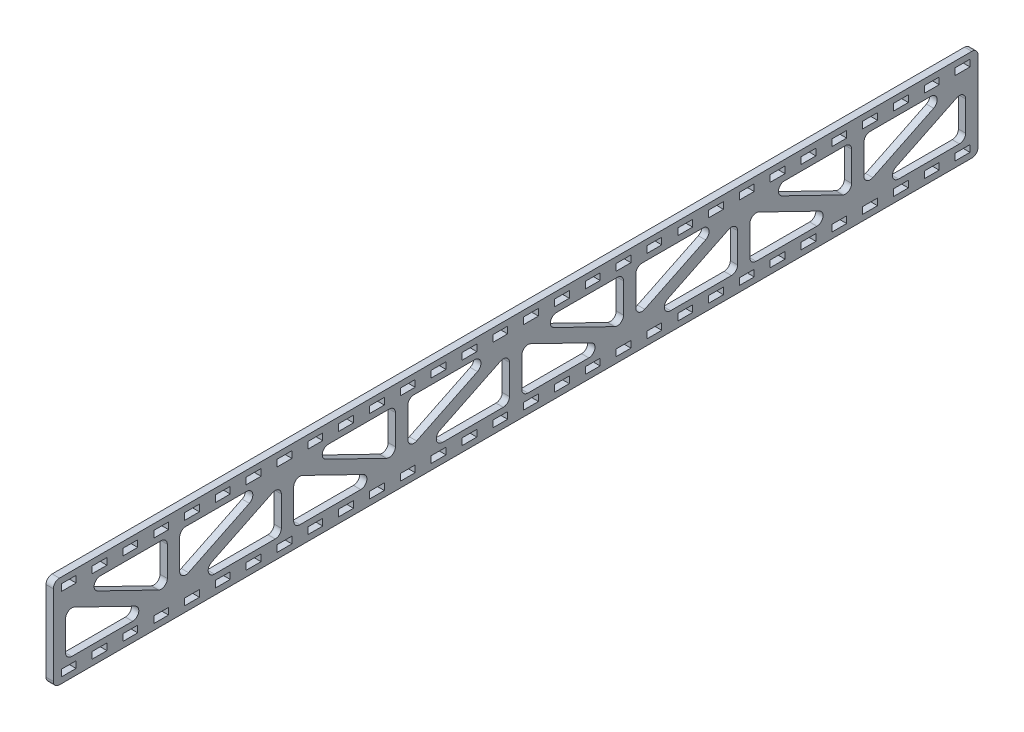
from build123d import *

# Parameters (mm, degrees)
SKETCH1_W          = 381
SKETCH1_H          = 38.1
OUTER_CUT_DEPTH    = 1.4986
CUT_EXTRUDE1_DEPTH = 192.473590105
FILLET1_R          = 2.54
SKETCH2_W          = 6.096
SKETCH2_H          = 2.746000096
SLOT_DEPTH         = 192.473590105
SLOTS_COUNT        = 16
SLOTS_PITCH        = 12.7
SLOTS_COUNT_DIR2   = 16
SLOTS_PITCH_DIR2   = 12.7


with BuildPart() as part:
    # Sketch1 → Outer Cut (new, symmetric)
    with BuildSketch(Plane(origin=(0, 0, 0), x_dir=(0, 0, -1), z_dir=(1, 0, 0))):
        Rectangle(SKETCH1_W, SKETCH1_H)
    extrude(amount=OUTER_CUT_DEPTH, both=True)

    # Sketch3 → Cut-Extrude1 (cut, through all)
    with BuildSketch(Plane(origin=(1.4986, 0, 0), x_dir=(0, 0, -1), z_dir=(1, 0, 0))):
        Polygon((-185.42, 7.369701451), (-185.42, -11.43), (-146.776169239, -11.43), align=None)
        Polygon((-143.51, 11.43), (-182.153830761, 11.43), (-143.51, -7.369701451), align=None)
        Polygon((-99.786169239, 11.43), (-138.43, 11.43), (-138.43, -7.369701451), align=None)
        Polygon((-96.52, 7.369701451), (-135.163830761, -11.43), (-96.52, -11.43), align=None)
        Polygon((-91.44, 7.369701451), (-91.44, -11.43), (-52.796169239, -11.43), align=None)
        Polygon((-49.53, 11.43), (-88.173830761, 11.43), (-49.53, -7.369701451), align=None)
        Polygon((-5.806169239, 11.43), (-44.45, 11.43), (-44.45, -7.369701451), align=None)
        Polygon((-41.183830761, -11.43), (-2.54, -11.43), (-2.54, 7.369701451), align=None)
        Polygon((2.54, -11.43), (41.183830761, -11.43), (2.54, 7.369701451), align=None)
        Polygon((44.45, -7.369701451), (44.45, 11.43), (5.806169239, 11.43), align=None)
        Polygon((49.53, -7.369701451), (88.173830761, 11.43), (49.53, 11.43), align=None)
        Polygon((52.796169239, -11.43), (91.44, -11.43), (91.44, 7.369701451), align=None)
        Polygon((96.52, -11.43), (135.163830761, -11.43), (96.52, 7.369701451), align=None)
        Polygon((138.43, -7.369701451), (138.43, 11.43), (99.786169239, 11.43), align=None)
        Polygon((143.51, -7.369701451), (182.153830761, 11.43), (143.51, 11.43), align=None)
        Polygon((146.776169239, -11.43), (185.42, -11.43), (185.42, 7.369701451), align=None)
    extrude(amount=-CUT_EXTRUDE1_DEPTH, mode=Mode.SUBTRACT)

    # Fillet1
    fillet1_edges = [part.edges().sort_by_distance(p)[0] for p in [
        (0, 7.369701451, 91.44),
        (0, -11.43, 52.796169239),
        (0, -11.43, 91.44),
        (0, 11.43, -99.786169239),
        (0, 11.43, -138.43),
        (0, -7.369701451, -138.43),
        (0, -7.369701451, -143.51),
        (0, 11.43, -143.51),
        (0, 11.43, -182.153830761),
        (0, 7.369701451, -185.42),
        (0, -11.43, -185.42),
        (0, -11.43, -146.776169239),
        (0, 11.43, -5.806169239),
        (0, 11.43, -44.45),
        (0, -7.369701451, -44.45),
        (0, -7.369701451, -49.53),
        (0, 11.43, -49.53),
        (0, 11.43, -88.173830761),
        (0, -11.43, -52.796169239),
        (0, 7.369701451, -91.44),
        (0, -11.43, -91.44),
        (0, 7.369701451, -96.52),
        (0, -11.43, -135.163830761),
        (0, -11.43, -96.52),
        (0, 7.369701451, 185.42),
        (0, -11.43, 146.776169239),
        (0, -11.43, 185.42),
        (0, 11.43, 88.173830761),
        (0, 11.43, 49.53),
        (0, -7.369701451, 49.53),
        (0, -7.369701451, 44.45),
        (0, 11.43, 44.45),
        (0, 11.43, 5.806169239),
        (0, -11.43, 41.183830761),
        (0, 7.369701451, 2.54),
        (0, 19.05, 190.5),
        (0, -11.43, 2.54),
        (0, 19.05, -190.5),
        (0, -19.05, -190.5),
        (0, -19.05, 190.5),
        (0, 7.369701451, -2.54),
        (0, -11.43, -41.183830761),
        (0, -11.43, -2.54),
        (0, 11.43, 182.153830761),
        (0, 11.43, 143.51),
        (0, -7.369701451, 143.51),
        (0, -7.369701451, 138.43),
        (0, 11.43, 138.43),
        (0, 11.43, 99.786169239),
        (0, -11.43, 135.163830761),
        (0, 7.369701451, 96.52),
        (0, -11.43, 96.52),
    ]]
    fillet(fillet1_edges, radius=FILLET1_R)

    # Sketch2 → Slot (cut, through all)
    with BuildSketch(Plane(origin=(1.4986, 0, 0), x_dir=(0, 0, -1), z_dir=(1, 0, 0))):
        with Locations((6.35, 15.24)):
            Rectangle(SKETCH2_W, SKETCH2_H)
    slot = extrude(amount=-SLOT_DEPTH, mode=Mode.SUBTRACT)

    # Slots: Slot 16 × 16
    with Locations(*[Vector(0, 0, 1) * (i * SLOTS_PITCH) + Vector(0, 0, -1) * (j * SLOTS_PITCH_DIR2) for i in range(SLOTS_COUNT) for j in range(SLOTS_COUNT_DIR2) if (i, j) != (0, 0)]):
        add(slot, mode=Mode.SUBTRACT)

    # Mirror1: read off the stored shape, not the designer's step
    # Mirror1: loft between two sections, ruled curve by curve
    mirror1_from = [
        Edge.make_line((1.4986, -13.866999952, -9.398), (1.4986, -16.613000048, -9.398)),
        Edge.make_line((1.4986, -16.613000048, -3.302), (1.4986, -13.866999952, -3.302)),
        Edge.make_line((1.4986, -16.613000048, -9.398), (1.4986, -16.613000048, -3.302)),
        Edge.make_line((1.4986, -13.866999952, -3.302), (1.4986, -13.866999952, -9.398)),
    ]
    mirror1_to = [
        Edge.make_line((-1.4986, -13.866999952, -9.398), (-1.4986, -16.613000048, -9.398)),
        Edge.make_line((-1.4986, -16.613000048, -3.302), (-1.4986, -13.866999952, -3.302)),
        Edge.make_line((-1.4986, -16.613000048, -9.398), (-1.4986, -16.613000048, -3.302)),
        Edge.make_line((-1.4986, -13.866999952, -3.302), (-1.4986, -13.866999952, -9.398)),
    ]
    mirror1 = Solid(Shell([*[Face.make_surface_from_curves(mirror1_from[k], mirror1_to[k]) for k in range(4)], Face(Wire(mirror1_from)), Face(Wire(mirror1_to))]))
    add(mirror1, mode=Mode.SUBTRACT)

    # Mirror1 2: loft between two sections, ruled curve by curve
    mirror1_2_from = [
        Edge.make_line((1.4986, -13.866999952, -22.098), (1.4986, -16.613000048, -22.098)),
        Edge.make_line((1.4986, -16.613000048, -16.002), (1.4986, -13.866999952, -16.002)),
        Edge.make_line((1.4986, -16.613000048, -22.098), (1.4986, -16.613000048, -16.002)),
        Edge.make_line((1.4986, -13.866999952, -16.002), (1.4986, -13.866999952, -22.098)),
    ]
    mirror1_2_to = [
        Edge.make_line((-1.4986, -13.866999952, -22.098), (-1.4986, -16.613000048, -22.098)),
        Edge.make_line((-1.4986, -16.613000048, -16.002), (-1.4986, -13.866999952, -16.002)),
        Edge.make_line((-1.4986, -16.613000048, -22.098), (-1.4986, -16.613000048, -16.002)),
        Edge.make_line((-1.4986, -13.866999952, -16.002), (-1.4986, -13.866999952, -22.098)),
    ]
    mirror1_2 = Solid(Shell([*[Face.make_surface_from_curves(mirror1_2_from[k], mirror1_2_to[k]) for k in range(4)], Face(Wire(mirror1_2_from)), Face(Wire(mirror1_2_to))]))
    add(mirror1_2, mode=Mode.SUBTRACT)

    # Mirror1 3: loft between two sections, ruled curve by curve
    mirror1_3_from = [
        Edge.make_line((1.4986, -13.866999952, -136.398), (1.4986, -16.613000048, -136.398)),
        Edge.make_line((1.4986, -16.613000048, -130.302), (1.4986, -13.866999952, -130.302)),
        Edge.make_line((1.4986, -16.613000048, -136.398), (1.4986, -16.613000048, -130.302)),
        Edge.make_line((1.4986, -13.866999952, -130.302), (1.4986, -13.866999952, -136.398)),
    ]
    mirror1_3_to = [
        Edge.make_line((-1.4986, -13.866999952, -136.398), (-1.4986, -16.613000048, -136.398)),
        Edge.make_line((-1.4986, -16.613000048, -130.302), (-1.4986, -13.866999952, -130.302)),
        Edge.make_line((-1.4986, -16.613000048, -136.398), (-1.4986, -16.613000048, -130.302)),
        Edge.make_line((-1.4986, -13.866999952, -130.302), (-1.4986, -13.866999952, -136.398)),
    ]
    mirror1_3 = Solid(Shell([*[Face.make_surface_from_curves(mirror1_3_from[k], mirror1_3_to[k]) for k in range(4)], Face(Wire(mirror1_3_from)), Face(Wire(mirror1_3_to))]))
    add(mirror1_3, mode=Mode.SUBTRACT)

    # Mirror1 4: loft between two sections, ruled curve by curve
    mirror1_4_from = [
        Edge.make_line((1.4986, -13.866999952, -149.098), (1.4986, -16.613000048, -149.098)),
        Edge.make_line((1.4986, -16.613000048, -143.002), (1.4986, -13.866999952, -143.002)),
        Edge.make_line((1.4986, -16.613000048, -149.098), (1.4986, -16.613000048, -143.002)),
        Edge.make_line((1.4986, -13.866999952, -143.002), (1.4986, -13.866999952, -149.098)),
    ]
    mirror1_4_to = [
        Edge.make_line((-1.4986, -13.866999952, -149.098), (-1.4986, -16.613000048, -149.098)),
        Edge.make_line((-1.4986, -16.613000048, -143.002), (-1.4986, -13.866999952, -143.002)),
        Edge.make_line((-1.4986, -16.613000048, -149.098), (-1.4986, -16.613000048, -143.002)),
        Edge.make_line((-1.4986, -13.866999952, -143.002), (-1.4986, -13.866999952, -149.098)),
    ]
    mirror1_4 = Solid(Shell([*[Face.make_surface_from_curves(mirror1_4_from[k], mirror1_4_to[k]) for k in range(4)], Face(Wire(mirror1_4_from)), Face(Wire(mirror1_4_to))]))
    add(mirror1_4, mode=Mode.SUBTRACT)

    # Mirror1 5: loft between two sections, ruled curve by curve
    mirror1_5_from = [
        Edge.make_line((1.4986, -13.866999952, -161.798), (1.4986, -16.613000048, -161.798)),
        Edge.make_line((1.4986, -16.613000048, -155.702), (1.4986, -13.866999952, -155.702)),
        Edge.make_line((1.4986, -16.613000048, -161.798), (1.4986, -16.613000048, -155.702)),
        Edge.make_line((1.4986, -13.866999952, -155.702), (1.4986, -13.866999952, -161.798)),
    ]
    mirror1_5_to = [
        Edge.make_line((-1.4986, -13.866999952, -161.798), (-1.4986, -16.613000048, -161.798)),
        Edge.make_line((-1.4986, -16.613000048, -155.702), (-1.4986, -13.866999952, -155.702)),
        Edge.make_line((-1.4986, -16.613000048, -161.798), (-1.4986, -16.613000048, -155.702)),
        Edge.make_line((-1.4986, -13.866999952, -155.702), (-1.4986, -13.866999952, -161.798)),
    ]
    mirror1_5 = Solid(Shell([*[Face.make_surface_from_curves(mirror1_5_from[k], mirror1_5_to[k]) for k in range(4)], Face(Wire(mirror1_5_from)), Face(Wire(mirror1_5_to))]))
    add(mirror1_5, mode=Mode.SUBTRACT)

    # Mirror1 6: loft between two sections, ruled curve by curve
    mirror1_6_from = [
        Edge.make_line((1.4986, -13.866999952, -174.498), (1.4986, -16.613000048, -174.498)),
        Edge.make_line((1.4986, -16.613000048, -168.402), (1.4986, -13.866999952, -168.402)),
        Edge.make_line((1.4986, -16.613000048, -174.498), (1.4986, -16.613000048, -168.402)),
        Edge.make_line((1.4986, -13.866999952, -168.402), (1.4986, -13.866999952, -174.498)),
    ]
    mirror1_6_to = [
        Edge.make_line((-1.4986, -13.866999952, -174.498), (-1.4986, -16.613000048, -174.498)),
        Edge.make_line((-1.4986, -16.613000048, -168.402), (-1.4986, -13.866999952, -168.402)),
        Edge.make_line((-1.4986, -16.613000048, -174.498), (-1.4986, -16.613000048, -168.402)),
        Edge.make_line((-1.4986, -13.866999952, -168.402), (-1.4986, -13.866999952, -174.498)),
    ]
    mirror1_6 = Solid(Shell([*[Face.make_surface_from_curves(mirror1_6_from[k], mirror1_6_to[k]) for k in range(4)], Face(Wire(mirror1_6_from)), Face(Wire(mirror1_6_to))]))
    add(mirror1_6, mode=Mode.SUBTRACT)

    # Mirror1 7: loft between two sections, ruled curve by curve
    mirror1_7_from = [
        Edge.make_line((1.4986, -13.866999952, -187.198), (1.4986, -16.613000048, -187.198)),
        Edge.make_line((1.4986, -16.613000048, -181.102), (1.4986, -13.866999952, -181.102)),
        Edge.make_line((1.4986, -16.613000048, -187.198), (1.4986, -16.613000048, -181.102)),
        Edge.make_line((1.4986, -13.866999952, -181.102), (1.4986, -13.866999952, -187.198)),
    ]
    mirror1_7_to = [
        Edge.make_line((-1.4986, -13.866999952, -187.198), (-1.4986, -16.613000048, -187.198)),
        Edge.make_line((-1.4986, -16.613000048, -181.102), (-1.4986, -13.866999952, -181.102)),
        Edge.make_line((-1.4986, -16.613000048, -187.198), (-1.4986, -16.613000048, -181.102)),
        Edge.make_line((-1.4986, -13.866999952, -181.102), (-1.4986, -13.866999952, -187.198)),
    ]
    mirror1_7 = Solid(Shell([*[Face.make_surface_from_curves(mirror1_7_from[k], mirror1_7_to[k]) for k in range(4)], Face(Wire(mirror1_7_from)), Face(Wire(mirror1_7_to))]))
    add(mirror1_7, mode=Mode.SUBTRACT)

    # Mirror1 8: loft between two sections, ruled curve by curve
    mirror1_8_from = [
        Edge.make_line((1.4986, -13.866999952, 3.302), (1.4986, -16.613000048, 3.302)),
        Edge.make_line((1.4986, -16.613000048, 9.398), (1.4986, -13.866999952, 9.398)),
        Edge.make_line((1.4986, -16.613000048, 3.302), (1.4986, -16.613000048, 9.398)),
        Edge.make_line((1.4986, -13.866999952, 9.398), (1.4986, -13.866999952, 3.302)),
    ]
    mirror1_8_to = [
        Edge.make_line((-1.4986, -13.866999952, 3.302), (-1.4986, -16.613000048, 3.302)),
        Edge.make_line((-1.4986, -16.613000048, 9.398), (-1.4986, -13.866999952, 9.398)),
        Edge.make_line((-1.4986, -16.613000048, 3.302), (-1.4986, -16.613000048, 9.398)),
        Edge.make_line((-1.4986, -13.866999952, 9.398), (-1.4986, -13.866999952, 3.302)),
    ]
    mirror1_8 = Solid(Shell([*[Face.make_surface_from_curves(mirror1_8_from[k], mirror1_8_to[k]) for k in range(4)], Face(Wire(mirror1_8_from)), Face(Wire(mirror1_8_to))]))
    add(mirror1_8, mode=Mode.SUBTRACT)

    # Mirror1 9: loft between two sections, ruled curve by curve
    mirror1_9_from = [
        Edge.make_line((1.4986, -13.866999952, 16.002), (1.4986, -16.613000048, 16.002)),
        Edge.make_line((1.4986, -16.613000048, 22.098), (1.4986, -13.866999952, 22.098)),
        Edge.make_line((1.4986, -16.613000048, 16.002), (1.4986, -16.613000048, 22.098)),
        Edge.make_line((1.4986, -13.866999952, 22.098), (1.4986, -13.866999952, 16.002)),
    ]
    mirror1_9_to = [
        Edge.make_line((-1.4986, -13.866999952, 16.002), (-1.4986, -16.613000048, 16.002)),
        Edge.make_line((-1.4986, -16.613000048, 22.098), (-1.4986, -13.866999952, 22.098)),
        Edge.make_line((-1.4986, -16.613000048, 16.002), (-1.4986, -16.613000048, 22.098)),
        Edge.make_line((-1.4986, -13.866999952, 22.098), (-1.4986, -13.866999952, 16.002)),
    ]
    mirror1_9 = Solid(Shell([*[Face.make_surface_from_curves(mirror1_9_from[k], mirror1_9_to[k]) for k in range(4)], Face(Wire(mirror1_9_from)), Face(Wire(mirror1_9_to))]))
    add(mirror1_9, mode=Mode.SUBTRACT)

    # Mirror1 10: loft between two sections, ruled curve by curve
    mirror1_10_from = [
        Edge.make_line((1.4986, -13.866999952, -123.698), (1.4986, -16.613000048, -123.698)),
        Edge.make_line((1.4986, -16.613000048, -117.602), (1.4986, -13.866999952, -117.602)),
        Edge.make_line((1.4986, -16.613000048, -123.698), (1.4986, -16.613000048, -117.602)),
        Edge.make_line((1.4986, -13.866999952, -117.602), (1.4986, -13.866999952, -123.698)),
    ]
    mirror1_10_to = [
        Edge.make_line((-1.4986, -13.866999952, -123.698), (-1.4986, -16.613000048, -123.698)),
        Edge.make_line((-1.4986, -16.613000048, -117.602), (-1.4986, -13.866999952, -117.602)),
        Edge.make_line((-1.4986, -16.613000048, -123.698), (-1.4986, -16.613000048, -117.602)),
        Edge.make_line((-1.4986, -13.866999952, -117.602), (-1.4986, -13.866999952, -123.698)),
    ]
    mirror1_10 = Solid(Shell([*[Face.make_surface_from_curves(mirror1_10_from[k], mirror1_10_to[k]) for k in range(4)], Face(Wire(mirror1_10_from)), Face(Wire(mirror1_10_to))]))
    add(mirror1_10, mode=Mode.SUBTRACT)

    # Mirror1 11: loft between two sections, ruled curve by curve
    mirror1_11_from = [
        Edge.make_line((1.4986, -13.866999952, -110.998), (1.4986, -16.613000048, -110.998)),
        Edge.make_line((1.4986, -16.613000048, -104.902), (1.4986, -13.866999952, -104.902)),
        Edge.make_line((1.4986, -16.613000048, -110.998), (1.4986, -16.613000048, -104.902)),
        Edge.make_line((1.4986, -13.866999952, -104.902), (1.4986, -13.866999952, -110.998)),
    ]
    mirror1_11_to = [
        Edge.make_line((-1.4986, -13.866999952, -110.998), (-1.4986, -16.613000048, -110.998)),
        Edge.make_line((-1.4986, -16.613000048, -104.902), (-1.4986, -13.866999952, -104.902)),
        Edge.make_line((-1.4986, -16.613000048, -110.998), (-1.4986, -16.613000048, -104.902)),
        Edge.make_line((-1.4986, -13.866999952, -104.902), (-1.4986, -13.866999952, -110.998)),
    ]
    mirror1_11 = Solid(Shell([*[Face.make_surface_from_curves(mirror1_11_from[k], mirror1_11_to[k]) for k in range(4)], Face(Wire(mirror1_11_from)), Face(Wire(mirror1_11_to))]))
    add(mirror1_11, mode=Mode.SUBTRACT)

    # Mirror1 12: loft between two sections, ruled curve by curve
    mirror1_12_from = [
        Edge.make_line((1.4986, -13.866999952, -98.298), (1.4986, -16.613000048, -98.298)),
        Edge.make_line((1.4986, -16.613000048, -92.202), (1.4986, -13.866999952, -92.202)),
        Edge.make_line((1.4986, -16.613000048, -98.298), (1.4986, -16.613000048, -92.202)),
        Edge.make_line((1.4986, -13.866999952, -92.202), (1.4986, -13.866999952, -98.298)),
    ]
    mirror1_12_to = [
        Edge.make_line((-1.4986, -13.866999952, -98.298), (-1.4986, -16.613000048, -98.298)),
        Edge.make_line((-1.4986, -16.613000048, -92.202), (-1.4986, -13.866999952, -92.202)),
        Edge.make_line((-1.4986, -16.613000048, -98.298), (-1.4986, -16.613000048, -92.202)),
        Edge.make_line((-1.4986, -13.866999952, -92.202), (-1.4986, -13.866999952, -98.298)),
    ]
    mirror1_12 = Solid(Shell([*[Face.make_surface_from_curves(mirror1_12_from[k], mirror1_12_to[k]) for k in range(4)], Face(Wire(mirror1_12_from)), Face(Wire(mirror1_12_to))]))
    add(mirror1_12, mode=Mode.SUBTRACT)

    # Mirror1 13: loft between two sections, ruled curve by curve
    mirror1_13_from = [
        Edge.make_line((1.4986, -13.866999952, -85.598), (1.4986, -16.613000048, -85.598)),
        Edge.make_line((1.4986, -16.613000048, -79.502), (1.4986, -13.866999952, -79.502)),
        Edge.make_line((1.4986, -16.613000048, -85.598), (1.4986, -16.613000048, -79.502)),
        Edge.make_line((1.4986, -13.866999952, -79.502), (1.4986, -13.866999952, -85.598)),
    ]
    mirror1_13_to = [
        Edge.make_line((-1.4986, -13.866999952, -85.598), (-1.4986, -16.613000048, -85.598)),
        Edge.make_line((-1.4986, -16.613000048, -79.502), (-1.4986, -13.866999952, -79.502)),
        Edge.make_line((-1.4986, -16.613000048, -85.598), (-1.4986, -16.613000048, -79.502)),
        Edge.make_line((-1.4986, -13.866999952, -79.502), (-1.4986, -13.866999952, -85.598)),
    ]
    mirror1_13 = Solid(Shell([*[Face.make_surface_from_curves(mirror1_13_from[k], mirror1_13_to[k]) for k in range(4)], Face(Wire(mirror1_13_from)), Face(Wire(mirror1_13_to))]))
    add(mirror1_13, mode=Mode.SUBTRACT)

    # Mirror1 14: loft between two sections, ruled curve by curve
    mirror1_14_from = [
        Edge.make_line((1.4986, -13.866999952, -72.898), (1.4986, -16.613000048, -72.898)),
        Edge.make_line((1.4986, -16.613000048, -66.802), (1.4986, -13.866999952, -66.802)),
        Edge.make_line((1.4986, -16.613000048, -72.898), (1.4986, -16.613000048, -66.802)),
        Edge.make_line((1.4986, -13.866999952, -66.802), (1.4986, -13.866999952, -72.898)),
    ]
    mirror1_14_to = [
        Edge.make_line((-1.4986, -13.866999952, -72.898), (-1.4986, -16.613000048, -72.898)),
        Edge.make_line((-1.4986, -16.613000048, -66.802), (-1.4986, -13.866999952, -66.802)),
        Edge.make_line((-1.4986, -16.613000048, -72.898), (-1.4986, -16.613000048, -66.802)),
        Edge.make_line((-1.4986, -13.866999952, -66.802), (-1.4986, -13.866999952, -72.898)),
    ]
    mirror1_14 = Solid(Shell([*[Face.make_surface_from_curves(mirror1_14_from[k], mirror1_14_to[k]) for k in range(4)], Face(Wire(mirror1_14_from)), Face(Wire(mirror1_14_to))]))
    add(mirror1_14, mode=Mode.SUBTRACT)

    # Mirror1 15: loft between two sections, ruled curve by curve
    mirror1_15_from = [
        Edge.make_line((1.4986, -13.866999952, -60.198), (1.4986, -16.613000048, -60.198)),
        Edge.make_line((1.4986, -16.613000048, -54.102), (1.4986, -13.866999952, -54.102)),
        Edge.make_line((1.4986, -16.613000048, -60.198), (1.4986, -16.613000048, -54.102)),
        Edge.make_line((1.4986, -13.866999952, -54.102), (1.4986, -13.866999952, -60.198)),
    ]
    mirror1_15_to = [
        Edge.make_line((-1.4986, -13.866999952, -60.198), (-1.4986, -16.613000048, -60.198)),
        Edge.make_line((-1.4986, -16.613000048, -54.102), (-1.4986, -13.866999952, -54.102)),
        Edge.make_line((-1.4986, -16.613000048, -60.198), (-1.4986, -16.613000048, -54.102)),
        Edge.make_line((-1.4986, -13.866999952, -54.102), (-1.4986, -13.866999952, -60.198)),
    ]
    mirror1_15 = Solid(Shell([*[Face.make_surface_from_curves(mirror1_15_from[k], mirror1_15_to[k]) for k in range(4)], Face(Wire(mirror1_15_from)), Face(Wire(mirror1_15_to))]))
    add(mirror1_15, mode=Mode.SUBTRACT)

    # Mirror1 16: loft between two sections, ruled curve by curve
    mirror1_16_from = [
        Edge.make_line((1.4986, -13.866999952, -47.498), (1.4986, -16.613000048, -47.498)),
        Edge.make_line((1.4986, -16.613000048, -41.402), (1.4986, -13.866999952, -41.402)),
        Edge.make_line((1.4986, -16.613000048, -47.498), (1.4986, -16.613000048, -41.402)),
        Edge.make_line((1.4986, -13.866999952, -41.402), (1.4986, -13.866999952, -47.498)),
    ]
    mirror1_16_to = [
        Edge.make_line((-1.4986, -13.866999952, -47.498), (-1.4986, -16.613000048, -47.498)),
        Edge.make_line((-1.4986, -16.613000048, -41.402), (-1.4986, -13.866999952, -41.402)),
        Edge.make_line((-1.4986, -16.613000048, -47.498), (-1.4986, -16.613000048, -41.402)),
        Edge.make_line((-1.4986, -13.866999952, -41.402), (-1.4986, -13.866999952, -47.498)),
    ]
    mirror1_16 = Solid(Shell([*[Face.make_surface_from_curves(mirror1_16_from[k], mirror1_16_to[k]) for k in range(4)], Face(Wire(mirror1_16_from)), Face(Wire(mirror1_16_to))]))
    add(mirror1_16, mode=Mode.SUBTRACT)

    # Mirror1 17: loft between two sections, ruled curve by curve
    mirror1_17_from = [
        Edge.make_line((1.4986, -13.866999952, -34.798), (1.4986, -16.613000048, -34.798)),
        Edge.make_line((1.4986, -16.613000048, -28.702), (1.4986, -13.866999952, -28.702)),
        Edge.make_line((1.4986, -16.613000048, -34.798), (1.4986, -16.613000048, -28.702)),
        Edge.make_line((1.4986, -13.866999952, -28.702), (1.4986, -13.866999952, -34.798)),
    ]
    mirror1_17_to = [
        Edge.make_line((-1.4986, -13.866999952, -34.798), (-1.4986, -16.613000048, -34.798)),
        Edge.make_line((-1.4986, -16.613000048, -28.702), (-1.4986, -13.866999952, -28.702)),
        Edge.make_line((-1.4986, -16.613000048, -34.798), (-1.4986, -16.613000048, -28.702)),
        Edge.make_line((-1.4986, -13.866999952, -28.702), (-1.4986, -13.866999952, -34.798)),
    ]
    mirror1_17 = Solid(Shell([*[Face.make_surface_from_curves(mirror1_17_from[k], mirror1_17_to[k]) for k in range(4)], Face(Wire(mirror1_17_from)), Face(Wire(mirror1_17_to))]))
    add(mirror1_17, mode=Mode.SUBTRACT)

    # Mirror1 18: loft between two sections, ruled curve by curve
    mirror1_18_from = [
        Edge.make_line((1.4986, -13.866999952, 28.702), (1.4986, -16.613000048, 28.702)),
        Edge.make_line((1.4986, -16.613000048, 34.798), (1.4986, -13.866999952, 34.798)),
        Edge.make_line((1.4986, -16.613000048, 28.702), (1.4986, -16.613000048, 34.798)),
        Edge.make_line((1.4986, -13.866999952, 34.798), (1.4986, -13.866999952, 28.702)),
    ]
    mirror1_18_to = [
        Edge.make_line((-1.4986, -13.866999952, 28.702), (-1.4986, -16.613000048, 28.702)),
        Edge.make_line((-1.4986, -16.613000048, 34.798), (-1.4986, -13.866999952, 34.798)),
        Edge.make_line((-1.4986, -16.613000048, 28.702), (-1.4986, -16.613000048, 34.798)),
        Edge.make_line((-1.4986, -13.866999952, 34.798), (-1.4986, -13.866999952, 28.702)),
    ]
    mirror1_18 = Solid(Shell([*[Face.make_surface_from_curves(mirror1_18_from[k], mirror1_18_to[k]) for k in range(4)], Face(Wire(mirror1_18_from)), Face(Wire(mirror1_18_to))]))
    add(mirror1_18, mode=Mode.SUBTRACT)

    # Mirror1 19: loft between two sections, ruled curve by curve
    mirror1_19_from = [
        Edge.make_line((1.4986, -13.866999952, 41.402), (1.4986, -16.613000048, 41.402)),
        Edge.make_line((1.4986, -16.613000048, 47.498), (1.4986, -13.866999952, 47.498)),
        Edge.make_line((1.4986, -16.613000048, 41.402), (1.4986, -16.613000048, 47.498)),
        Edge.make_line((1.4986, -13.866999952, 47.498), (1.4986, -13.866999952, 41.402)),
    ]
    mirror1_19_to = [
        Edge.make_line((-1.4986, -13.866999952, 41.402), (-1.4986, -16.613000048, 41.402)),
        Edge.make_line((-1.4986, -16.613000048, 47.498), (-1.4986, -13.866999952, 47.498)),
        Edge.make_line((-1.4986, -16.613000048, 41.402), (-1.4986, -16.613000048, 47.498)),
        Edge.make_line((-1.4986, -13.866999952, 47.498), (-1.4986, -13.866999952, 41.402)),
    ]
    mirror1_19 = Solid(Shell([*[Face.make_surface_from_curves(mirror1_19_from[k], mirror1_19_to[k]) for k in range(4)], Face(Wire(mirror1_19_from)), Face(Wire(mirror1_19_to))]))
    add(mirror1_19, mode=Mode.SUBTRACT)

    # Mirror1 20: loft between two sections, ruled curve by curve
    mirror1_20_from = [
        Edge.make_line((1.4986, -13.866999952, 54.102), (1.4986, -16.613000048, 54.102)),
        Edge.make_line((1.4986, -16.613000048, 60.198), (1.4986, -13.866999952, 60.198)),
        Edge.make_line((1.4986, -16.613000048, 54.102), (1.4986, -16.613000048, 60.198)),
        Edge.make_line((1.4986, -13.866999952, 60.198), (1.4986, -13.866999952, 54.102)),
    ]
    mirror1_20_to = [
        Edge.make_line((-1.4986, -13.866999952, 54.102), (-1.4986, -16.613000048, 54.102)),
        Edge.make_line((-1.4986, -16.613000048, 60.198), (-1.4986, -13.866999952, 60.198)),
        Edge.make_line((-1.4986, -16.613000048, 54.102), (-1.4986, -16.613000048, 60.198)),
        Edge.make_line((-1.4986, -13.866999952, 60.198), (-1.4986, -13.866999952, 54.102)),
    ]
    mirror1_20 = Solid(Shell([*[Face.make_surface_from_curves(mirror1_20_from[k], mirror1_20_to[k]) for k in range(4)], Face(Wire(mirror1_20_from)), Face(Wire(mirror1_20_to))]))
    add(mirror1_20, mode=Mode.SUBTRACT)

    # Mirror1 21: loft between two sections, ruled curve by curve
    mirror1_21_from = [
        Edge.make_line((1.4986, -13.866999952, 66.802), (1.4986, -16.613000048, 66.802)),
        Edge.make_line((1.4986, -16.613000048, 72.898), (1.4986, -13.866999952, 72.898)),
        Edge.make_line((1.4986, -16.613000048, 66.802), (1.4986, -16.613000048, 72.898)),
        Edge.make_line((1.4986, -13.866999952, 72.898), (1.4986, -13.866999952, 66.802)),
    ]
    mirror1_21_to = [
        Edge.make_line((-1.4986, -13.866999952, 66.802), (-1.4986, -16.613000048, 66.802)),
        Edge.make_line((-1.4986, -16.613000048, 72.898), (-1.4986, -13.866999952, 72.898)),
        Edge.make_line((-1.4986, -16.613000048, 66.802), (-1.4986, -16.613000048, 72.898)),
        Edge.make_line((-1.4986, -13.866999952, 72.898), (-1.4986, -13.866999952, 66.802)),
    ]
    mirror1_21 = Solid(Shell([*[Face.make_surface_from_curves(mirror1_21_from[k], mirror1_21_to[k]) for k in range(4)], Face(Wire(mirror1_21_from)), Face(Wire(mirror1_21_to))]))
    add(mirror1_21, mode=Mode.SUBTRACT)

    # Mirror1 22: loft between two sections, ruled curve by curve
    mirror1_22_from = [
        Edge.make_line((1.4986, -13.866999952, 79.502), (1.4986, -16.613000048, 79.502)),
        Edge.make_line((1.4986, -16.613000048, 85.598), (1.4986, -13.866999952, 85.598)),
        Edge.make_line((1.4986, -16.613000048, 79.502), (1.4986, -16.613000048, 85.598)),
        Edge.make_line((1.4986, -13.866999952, 85.598), (1.4986, -13.866999952, 79.502)),
    ]
    mirror1_22_to = [
        Edge.make_line((-1.4986, -13.866999952, 79.502), (-1.4986, -16.613000048, 79.502)),
        Edge.make_line((-1.4986, -16.613000048, 85.598), (-1.4986, -13.866999952, 85.598)),
        Edge.make_line((-1.4986, -16.613000048, 79.502), (-1.4986, -16.613000048, 85.598)),
        Edge.make_line((-1.4986, -13.866999952, 85.598), (-1.4986, -13.866999952, 79.502)),
    ]
    mirror1_22 = Solid(Shell([*[Face.make_surface_from_curves(mirror1_22_from[k], mirror1_22_to[k]) for k in range(4)], Face(Wire(mirror1_22_from)), Face(Wire(mirror1_22_to))]))
    add(mirror1_22, mode=Mode.SUBTRACT)

    # Mirror1 23: loft between two sections, ruled curve by curve
    mirror1_23_from = [
        Edge.make_line((1.4986, -13.866999952, 92.202), (1.4986, -16.613000048, 92.202)),
        Edge.make_line((1.4986, -16.613000048, 98.298), (1.4986, -13.866999952, 98.298)),
        Edge.make_line((1.4986, -16.613000048, 92.202), (1.4986, -16.613000048, 98.298)),
        Edge.make_line((1.4986, -13.866999952, 98.298), (1.4986, -13.866999952, 92.202)),
    ]
    mirror1_23_to = [
        Edge.make_line((-1.4986, -13.866999952, 92.202), (-1.4986, -16.613000048, 92.202)),
        Edge.make_line((-1.4986, -16.613000048, 98.298), (-1.4986, -13.866999952, 98.298)),
        Edge.make_line((-1.4986, -16.613000048, 92.202), (-1.4986, -16.613000048, 98.298)),
        Edge.make_line((-1.4986, -13.866999952, 98.298), (-1.4986, -13.866999952, 92.202)),
    ]
    mirror1_23 = Solid(Shell([*[Face.make_surface_from_curves(mirror1_23_from[k], mirror1_23_to[k]) for k in range(4)], Face(Wire(mirror1_23_from)), Face(Wire(mirror1_23_to))]))
    add(mirror1_23, mode=Mode.SUBTRACT)

    # Mirror1 24: loft between two sections, ruled curve by curve
    mirror1_24_from = [
        Edge.make_line((1.4986, -13.866999952, 104.902), (1.4986, -16.613000048, 104.902)),
        Edge.make_line((1.4986, -16.613000048, 110.998), (1.4986, -13.866999952, 110.998)),
        Edge.make_line((1.4986, -16.613000048, 104.902), (1.4986, -16.613000048, 110.998)),
        Edge.make_line((1.4986, -13.866999952, 110.998), (1.4986, -13.866999952, 104.902)),
    ]
    mirror1_24_to = [
        Edge.make_line((-1.4986, -13.866999952, 104.902), (-1.4986, -16.613000048, 104.902)),
        Edge.make_line((-1.4986, -16.613000048, 110.998), (-1.4986, -13.866999952, 110.998)),
        Edge.make_line((-1.4986, -16.613000048, 104.902), (-1.4986, -16.613000048, 110.998)),
        Edge.make_line((-1.4986, -13.866999952, 110.998), (-1.4986, -13.866999952, 104.902)),
    ]
    mirror1_24 = Solid(Shell([*[Face.make_surface_from_curves(mirror1_24_from[k], mirror1_24_to[k]) for k in range(4)], Face(Wire(mirror1_24_from)), Face(Wire(mirror1_24_to))]))
    add(mirror1_24, mode=Mode.SUBTRACT)

    # Mirror1 25: loft between two sections, ruled curve by curve
    mirror1_25_from = [
        Edge.make_line((1.4986, -13.866999952, 117.602), (1.4986, -16.613000048, 117.602)),
        Edge.make_line((1.4986, -16.613000048, 123.698), (1.4986, -13.866999952, 123.698)),
        Edge.make_line((1.4986, -16.613000048, 117.602), (1.4986, -16.613000048, 123.698)),
        Edge.make_line((1.4986, -13.866999952, 123.698), (1.4986, -13.866999952, 117.602)),
    ]
    mirror1_25_to = [
        Edge.make_line((-1.4986, -13.866999952, 117.602), (-1.4986, -16.613000048, 117.602)),
        Edge.make_line((-1.4986, -16.613000048, 123.698), (-1.4986, -13.866999952, 123.698)),
        Edge.make_line((-1.4986, -16.613000048, 117.602), (-1.4986, -16.613000048, 123.698)),
        Edge.make_line((-1.4986, -13.866999952, 123.698), (-1.4986, -13.866999952, 117.602)),
    ]
    mirror1_25 = Solid(Shell([*[Face.make_surface_from_curves(mirror1_25_from[k], mirror1_25_to[k]) for k in range(4)], Face(Wire(mirror1_25_from)), Face(Wire(mirror1_25_to))]))
    add(mirror1_25, mode=Mode.SUBTRACT)

    # Mirror1 26: loft between two sections, ruled curve by curve
    mirror1_26_from = [
        Edge.make_line((1.4986, -13.866999952, 130.302), (1.4986, -16.613000048, 130.302)),
        Edge.make_line((1.4986, -16.613000048, 136.398), (1.4986, -13.866999952, 136.398)),
        Edge.make_line((1.4986, -16.613000048, 130.302), (1.4986, -16.613000048, 136.398)),
        Edge.make_line((1.4986, -13.866999952, 136.398), (1.4986, -13.866999952, 130.302)),
    ]
    mirror1_26_to = [
        Edge.make_line((-1.4986, -13.866999952, 130.302), (-1.4986, -16.613000048, 130.302)),
        Edge.make_line((-1.4986, -16.613000048, 136.398), (-1.4986, -13.866999952, 136.398)),
        Edge.make_line((-1.4986, -16.613000048, 130.302), (-1.4986, -16.613000048, 136.398)),
        Edge.make_line((-1.4986, -13.866999952, 136.398), (-1.4986, -13.866999952, 130.302)),
    ]
    mirror1_26 = Solid(Shell([*[Face.make_surface_from_curves(mirror1_26_from[k], mirror1_26_to[k]) for k in range(4)], Face(Wire(mirror1_26_from)), Face(Wire(mirror1_26_to))]))
    add(mirror1_26, mode=Mode.SUBTRACT)

    # Mirror1 27: loft between two sections, ruled curve by curve
    mirror1_27_from = [
        Edge.make_line((1.4986, -13.866999952, 143.002), (1.4986, -16.613000048, 143.002)),
        Edge.make_line((1.4986, -16.613000048, 149.098), (1.4986, -13.866999952, 149.098)),
        Edge.make_line((1.4986, -16.613000048, 143.002), (1.4986, -16.613000048, 149.098)),
        Edge.make_line((1.4986, -13.866999952, 149.098), (1.4986, -13.866999952, 143.002)),
    ]
    mirror1_27_to = [
        Edge.make_line((-1.4986, -13.866999952, 143.002), (-1.4986, -16.613000048, 143.002)),
        Edge.make_line((-1.4986, -16.613000048, 149.098), (-1.4986, -13.866999952, 149.098)),
        Edge.make_line((-1.4986, -16.613000048, 143.002), (-1.4986, -16.613000048, 149.098)),
        Edge.make_line((-1.4986, -13.866999952, 149.098), (-1.4986, -13.866999952, 143.002)),
    ]
    mirror1_27 = Solid(Shell([*[Face.make_surface_from_curves(mirror1_27_from[k], mirror1_27_to[k]) for k in range(4)], Face(Wire(mirror1_27_from)), Face(Wire(mirror1_27_to))]))
    add(mirror1_27, mode=Mode.SUBTRACT)

    # Mirror1 28: loft between two sections, ruled curve by curve
    mirror1_28_from = [
        Edge.make_line((1.4986, -13.866999952, 155.702), (1.4986, -16.613000048, 155.702)),
        Edge.make_line((1.4986, -16.613000048, 161.798), (1.4986, -13.866999952, 161.798)),
        Edge.make_line((1.4986, -16.613000048, 155.702), (1.4986, -16.613000048, 161.798)),
        Edge.make_line((1.4986, -13.866999952, 161.798), (1.4986, -13.866999952, 155.702)),
    ]
    mirror1_28_to = [
        Edge.make_line((-1.4986, -13.866999952, 155.702), (-1.4986, -16.613000048, 155.702)),
        Edge.make_line((-1.4986, -16.613000048, 161.798), (-1.4986, -13.866999952, 161.798)),
        Edge.make_line((-1.4986, -16.613000048, 155.702), (-1.4986, -16.613000048, 161.798)),
        Edge.make_line((-1.4986, -13.866999952, 161.798), (-1.4986, -13.866999952, 155.702)),
    ]
    mirror1_28 = Solid(Shell([*[Face.make_surface_from_curves(mirror1_28_from[k], mirror1_28_to[k]) for k in range(4)], Face(Wire(mirror1_28_from)), Face(Wire(mirror1_28_to))]))
    add(mirror1_28, mode=Mode.SUBTRACT)

    # Mirror1 29: loft between two sections, ruled curve by curve
    mirror1_29_from = [
        Edge.make_line((1.4986, -13.866999952, 168.402), (1.4986, -16.613000048, 168.402)),
        Edge.make_line((1.4986, -16.613000048, 174.498), (1.4986, -13.866999952, 174.498)),
        Edge.make_line((1.4986, -16.613000048, 168.402), (1.4986, -16.613000048, 174.498)),
        Edge.make_line((1.4986, -13.866999952, 174.498), (1.4986, -13.866999952, 168.402)),
    ]
    mirror1_29_to = [
        Edge.make_line((-1.4986, -13.866999952, 168.402), (-1.4986, -16.613000048, 168.402)),
        Edge.make_line((-1.4986, -16.613000048, 174.498), (-1.4986, -13.866999952, 174.498)),
        Edge.make_line((-1.4986, -16.613000048, 168.402), (-1.4986, -16.613000048, 174.498)),
        Edge.make_line((-1.4986, -13.866999952, 174.498), (-1.4986, -13.866999952, 168.402)),
    ]
    mirror1_29 = Solid(Shell([*[Face.make_surface_from_curves(mirror1_29_from[k], mirror1_29_to[k]) for k in range(4)], Face(Wire(mirror1_29_from)), Face(Wire(mirror1_29_to))]))
    add(mirror1_29, mode=Mode.SUBTRACT)

    # Mirror1 30: loft between two sections, ruled curve by curve
    mirror1_30_from = [
        Edge.make_line((1.4986, -13.866999952, 181.102), (1.4986, -16.613000048, 181.102)),
        Edge.make_line((1.4986, -16.613000048, 187.198), (1.4986, -13.866999952, 187.198)),
        Edge.make_line((1.4986, -16.613000048, 181.102), (1.4986, -16.613000048, 187.198)),
        Edge.make_line((1.4986, -13.866999952, 187.198), (1.4986, -13.866999952, 181.102)),
    ]
    mirror1_30_to = [
        Edge.make_line((-1.4986, -13.866999952, 181.102), (-1.4986, -16.613000048, 181.102)),
        Edge.make_line((-1.4986, -16.613000048, 187.198), (-1.4986, -13.866999952, 187.198)),
        Edge.make_line((-1.4986, -16.613000048, 181.102), (-1.4986, -16.613000048, 187.198)),
        Edge.make_line((-1.4986, -13.866999952, 187.198), (-1.4986, -13.866999952, 181.102)),
    ]
    mirror1_30 = Solid(Shell([*[Face.make_surface_from_curves(mirror1_30_from[k], mirror1_30_to[k]) for k in range(4)], Face(Wire(mirror1_30_from)), Face(Wire(mirror1_30_to))]))
    add(mirror1_30, mode=Mode.SUBTRACT)


solid = part.part
